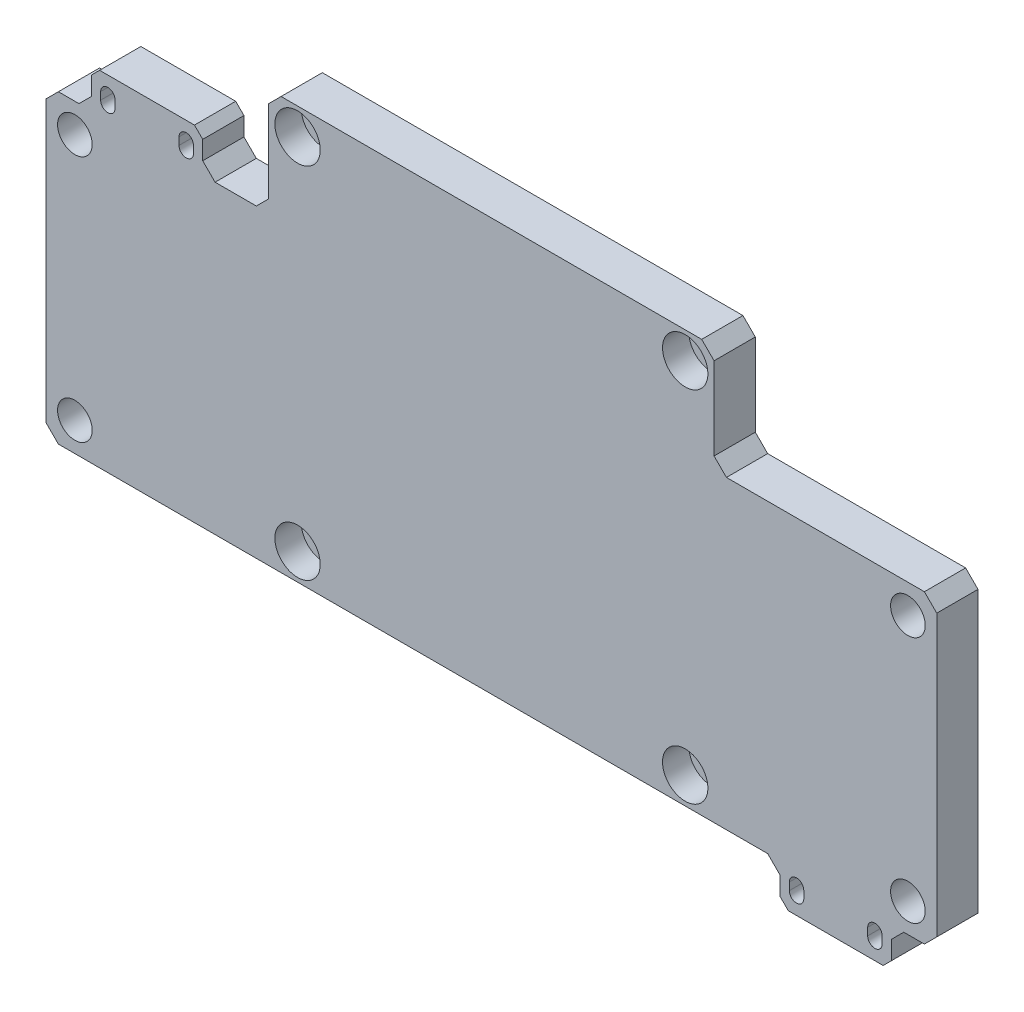
from build123d import *

# Parameters (mm, degrees)
SKIZZE1_W                                            = 216
SKIZZE1_H                                            = 100
AUFSATZ_LINEAR_AUSTRAGEN1_DEPTH                      = 10
STIRNSENKUNG_F_R_M6_ZYLINDERSCHRAUBE_MIT_D           = 6.6
STIRNSENKUNG_F_R_M6_ZYLINDERSCHRAUBE_MIT_DEPTH       = 15
STIRNSENKUNG_F_R_M6_ZYLINDERSCHRAUBE_MIT_CBORE_D     = 11
STIRNSENKUNG_F_R_M6_ZYLINDERSCHRAUBE_MIT_CBORE_DEPTH = 6.4
STIRNSENKUNG_F_R_M6_ZYLINDERSCHRAUBE_MIT_TIP         = 1.982840043
CBORE_FOR_M6_HEX_SOCKET_HEAD_CAP_SCREW1_D            = 6.6
CBORE_FOR_M6_HEX_SOCKET_HEAD_CAP_SCREW1_DEPTH        = 15
CBORE_FOR_M6_HEX_SOCKET_HEAD_CAP_SCREW1_CBORE_D      = 11
CBORE_FOR_M6_HEX_SOCKET_HEAD_CAP_SCREW1_CBORE_DEPTH  = 6.4
CBORE_FOR_M6_HEX_SOCKET_HEAD_CAP_SCREW1_TIP          = 1.982840043
M8_CLEARANCE_HOLE1_D                                 = 8.4
M8_CLEARANCE_HOLE1_DEPTH                             = 17
M8_CLEARANCE_HOLE1_TIP                               = 2.5236146
SKIZZE18_W                                           = 54
SKIZZE18_H                                           = 26
SCHNITT_LINEAR_AUSTRAGEN1_DEPTH                      = 15
SKETCH1_W                                            = 27
SKETCH1_H                                            = 10
BOSS_EXTRUDE1_DEPTH                                  = 9.5
CUT_EXTRUDE1_DEPTH                                   = 10
LPATTERN1_COUNT                                      = 2
LPATTERN1_PITCH                                      = 19
CUT_EXTRUDE2_START                                   = -10
CUT_EXTRUDE2_DEPTH                                   = 3
LPATTERN2_COUNT                                      = 2
LPATTERN2_PITCH                                      = 19
MIRROR1_COPY_1_DEPTH                                 = 10
MIRROR1_START                                        = -10
MIRROR1_COPY_2_DEPTH                                 = 3
SKETCH5_W                                            = 27
SKETCH5_H                                            = 9.5
CUT_EXTRUDE3_DEPTH                                   = 10
MIRROR2_COPY_1_DEPTH                                 = 10
MIRROR2_START                                        = -10
MIRROR2_COPY_2_DEPTH                                 = 3
CHAMFER1_SIZE                                        = 3
CHAMFER3_SIZE                                        = 2
CHAMFER4_SIZE                                        = 3
CHAMFER5_SIZE                                        = 3


with BuildPart() as part:
    # Skizze1 → Aufsatz-Linear austragen1 (new body)
    with BuildSketch(Plane.XY):
        Rectangle(SKIZZE1_W, SKIZZE1_H)
    extrude(amount=AUFSATZ_LINEAR_AUSTRAGEN1_DEPTH)

    # Stirnsenkung für M6 Zylinderschraube mit Innensechskant1
    with Locations(Plane.XY.offset(10)):
        with Locations((-47, -43.5), (47, -43.5)):
            CounterBoreHole(STIRNSENKUNG_F_R_M6_ZYLINDERSCHRAUBE_MIT_D / 2, STIRNSENKUNG_F_R_M6_ZYLINDERSCHRAUBE_MIT_CBORE_D / 2, STIRNSENKUNG_F_R_M6_ZYLINDERSCHRAUBE_MIT_CBORE_DEPTH, depth=STIRNSENKUNG_F_R_M6_ZYLINDERSCHRAUBE_MIT_DEPTH)
            with Locations((0, 0, -(STIRNSENKUNG_F_R_M6_ZYLINDERSCHRAUBE_MIT_DEPTH + STIRNSENKUNG_F_R_M6_ZYLINDERSCHRAUBE_MIT_TIP / 2))):  # 118° drill point
                Cone(0, STIRNSENKUNG_F_R_M6_ZYLINDERSCHRAUBE_MIT_D / 2, STIRNSENKUNG_F_R_M6_ZYLINDERSCHRAUBE_MIT_TIP, mode=Mode.SUBTRACT)

    # CBORE for M6 Hex Socket Head Cap Screw1
    with Locations(Plane.XY.offset(10)):
        with Locations((-47, 43.5), (47, 43.5)):
            CounterBoreHole(CBORE_FOR_M6_HEX_SOCKET_HEAD_CAP_SCREW1_D / 2, CBORE_FOR_M6_HEX_SOCKET_HEAD_CAP_SCREW1_CBORE_D / 2, CBORE_FOR_M6_HEX_SOCKET_HEAD_CAP_SCREW1_CBORE_DEPTH, depth=CBORE_FOR_M6_HEX_SOCKET_HEAD_CAP_SCREW1_DEPTH)
            with Locations((0, 0, -(CBORE_FOR_M6_HEX_SOCKET_HEAD_CAP_SCREW1_DEPTH + CBORE_FOR_M6_HEX_SOCKET_HEAD_CAP_SCREW1_TIP / 2))):  # 118° drill point
                Cone(0, CBORE_FOR_M6_HEX_SOCKET_HEAD_CAP_SCREW1_D / 2, CBORE_FOR_M6_HEX_SOCKET_HEAD_CAP_SCREW1_TIP, mode=Mode.SUBTRACT)

    # M8 Clearance Hole1
    with Locations(Plane.XY.offset(10)):
        with Locations((-101, 17), (-101, -43), (101, 17), (101, -43)):
            Hole(M8_CLEARANCE_HOLE1_D / 2, depth=M8_CLEARANCE_HOLE1_DEPTH)
            with Locations((0, 0, -(M8_CLEARANCE_HOLE1_DEPTH + M8_CLEARANCE_HOLE1_TIP / 2))):  # 118° drill point
                Cone(0, M8_CLEARANCE_HOLE1_D / 2, M8_CLEARANCE_HOLE1_TIP, mode=Mode.SUBTRACT)

    # Skizze18 → Schnitt-Linear austragen1 (cut)
    with BuildSketch(Plane.XY.offset(10)):
        with Locations((-81, 37)):
            Rectangle(SKIZZE18_W, SKIZZE18_H)
    schnitt_linear_austragen1 = extrude(amount=-SCHNITT_LINEAR_AUSTRAGEN1_DEPTH, mode=Mode.SUBTRACT)

    # Spiegeln1: Schnitt-Linear austragen1 across plane
    add(schnitt_linear_austragen1.mirror(Plane(origin=(0, 0, 0), x_dir=(0, 0, 1), z_dir=(1, 0, 0))), mode=Mode.SUBTRACT)

    # Sketch1 → Boss-Extrude1 (add)
    with BuildSketch(Plane(origin=(0, 24, 0), x_dir=(1, 0, 0), z_dir=(0, 1, 0))):
        with Locations((83.5, -5)):
            Rectangle(SKETCH1_W, SKETCH1_H)
    boss_extrude1 = extrude(amount=BOSS_EXTRUDE1_DEPTH)

    # Sketch3 → Cut-Extrude1 (cut)
    with BuildSketch(Plane(origin=(0, 0, 0), x_dir=(-1, 0, 0), z_dir=(0, 0, -1))):
        with BuildLine():
            Line((-91.25, 29.15), (-91.25, 27.35))
            ThreePointArc((-91.25, 27.35), (-93, 25.6), (-94.75, 27.35))
            Line((-94.75, 27.35), (-94.75, 29.15))
            ThreePointArc((-94.75, 29.15), (-93, 30.9), (-91.25, 29.15))
        make_face()
    cut_extrude1 = extrude(amount=-CUT_EXTRUDE1_DEPTH, mode=Mode.SUBTRACT)

    # LPattern1: Cut-Extrude1 ×2
    with Locations(*[(-i * LPATTERN1_PITCH, 0, 0) for i in range(1, LPATTERN1_COUNT)]):
        add(cut_extrude1, mode=Mode.SUBTRACT)

    # Sketch4 → Cut-Extrude2 (cut)
    with BuildSketch(Plane.XY.offset(10).offset(CUT_EXTRUDE2_START)):
        Polygon((74, 32.383161507), (71.2, 30.766580754), (71.2, 28.375279034), (71.2, 25.733419246), (74, 24.116838493), (76.8, 25.733419246), (76.8, 28.372780006), (76.8, 30.766580754), align=None)
    cut_extrude2 = extrude(amount=CUT_EXTRUDE2_DEPTH, mode=Mode.SUBTRACT)

    # LPattern2: Cut-Extrude2 ×2
    with Locations(*[(i * LPATTERN2_PITCH, 0, 0) for i in range(1, LPATTERN2_COUNT)]):
        add(cut_extrude2, mode=Mode.SUBTRACT)

    # Mirror1: Boss-Extrude1, Cut-Extrude1, Cut-Extrude2 across plane
    add(boss_extrude1.mirror(Plane.ZX.offset(-13)))
    add(cut_extrude1.mirror(Plane.ZX.offset(-13)), mode=Mode.SUBTRACT)
    add(cut_extrude2.mirror(Plane.ZX.offset(-13)), mode=Mode.SUBTRACT)

    # Mirror1 copy 1 sketch → Mirror1 copy 1 (cut)
    with BuildSketch(Plane(origin=(-19, -26, 0), x_dir=(-1, 0, 0), z_dir=(0, 0, -1))):
        with BuildLine():
            Line((-91.25, -29.15), (-91.25, -27.35))
            ThreePointArc((-91.25, -27.35), (-93, -25.6), (-94.75, -27.35))
            Line((-94.75, -27.35), (-94.75, -29.15))
            ThreePointArc((-94.75, -29.15), (-93, -30.9), (-91.25, -29.15))
        make_face()
    extrude(amount=-MIRROR1_COPY_1_DEPTH, mode=Mode.SUBTRACT)

    # Mirror1 copy 2 sketch → Mirror1 copy 2 (cut)
    with BuildSketch(Plane(origin=(19, -26, 10), x_dir=(1, 0, 0), z_dir=(0, 0, 1)).offset(MIRROR1_START)):
        Polygon((74, -32.383161507), (71.2, -30.766580754), (71.2, -28.375279034), (71.2, -25.733419246), (74, -24.116838493), (76.8, -25.733419246), (76.8, -28.372780006), (76.8, -30.766580754), align=None)
    extrude(amount=MIRROR1_COPY_2_DEPTH, mode=Mode.SUBTRACT)

    # Sketch5 → Cut-Extrude3 (cut)
    with BuildSketch(Plane.XY.offset(10)):
        with Locations((83.5, 28.75)):
            Rectangle(SKETCH5_W, SKETCH5_H)
    extrude(amount=-CUT_EXTRUDE3_DEPTH, mode=Mode.SUBTRACT)

    # Mirror2: Boss-Extrude1, Cut-Extrude1, Cut-Extrude2 across plane
    add(boss_extrude1.mirror(Plane(origin=(0, 0, 0), x_dir=(0, 0, 1), z_dir=(1, 0, 0))))
    add(cut_extrude1.mirror(Plane(origin=(0, 0, 0), x_dir=(0, 0, 1), z_dir=(1, 0, 0))), mode=Mode.SUBTRACT)
    add(cut_extrude2.mirror(Plane(origin=(0, 0, 0), x_dir=(0, 0, 1), z_dir=(1, 0, 0))), mode=Mode.SUBTRACT)

    # Mirror2 copy 1 sketch → Mirror2 copy 1 (cut)
    with BuildSketch(Plane(origin=(19, 0, 0), x_dir=(1, 0, 0), z_dir=(0, 0, -1))):
        with BuildLine():
            Line((-91.25, -29.15), (-91.25, -27.35))
            ThreePointArc((-91.25, -27.35), (-93, -25.6), (-94.75, -27.35))
            Line((-94.75, -27.35), (-94.75, -29.15))
            ThreePointArc((-94.75, -29.15), (-93, -30.9), (-91.25, -29.15))
        make_face()
    extrude(amount=-MIRROR2_COPY_1_DEPTH, mode=Mode.SUBTRACT)

    # Mirror2 copy 2 sketch → Mirror2 copy 2 (cut)
    with BuildSketch(Plane(origin=(-19, 0, 10), x_dir=(-1, 0, 0), z_dir=(0, 0, 1)).offset(MIRROR2_START)):
        Polygon((74, -32.383161507), (71.2, -30.766580754), (71.2, -28.375279034), (71.2, -25.733419246), (74, -24.116838493), (76.8, -25.733419246), (76.8, -28.372780006), (76.8, -30.766580754), align=None)
    extrude(amount=MIRROR2_COPY_2_DEPTH, mode=Mode.SUBTRACT)

    # Chamfer1
    chamfer1_edges = [part.edges().sort_by_distance(p)[0] for p in [
        (-70, 24, 5),
        (-97, 24, 5),
        (97, -50, 5),
        (70, -50, 5),
    ]]
    chamfer(chamfer1_edges, length=CHAMFER1_SIZE)

    # Chamfer3
    chamfer3_edges = [part.edges().sort_by_distance(p)[0] for p in [
        (-97, 33.5, 5),
        (-70, 33.5, 5),
        (70, -59.5, 5),
        (97, -59.5, 5),
    ]]
    chamfer(chamfer3_edges, length=CHAMFER3_SIZE)

    # Chamfer4
    chamfer4_edges = [part.edges().sort_by_distance(p)[0] for p in [
        (-54, 24, 5),
        (54, 24, 5),
    ]]
    chamfer(chamfer4_edges, length=CHAMFER4_SIZE)

    # Chamfer5
    chamfer5_edges = [part.edges().sort_by_distance(p)[0] for p in [
        (-54, 50, 5),
        (54, 50, 5),
        (108, -50, 5),
        (108, 24, 5),
        (-108, -50, 5),
        (-108, 24, 5),
    ]]
    chamfer(chamfer5_edges, length=CHAMFER5_SIZE)


solid = part.part
